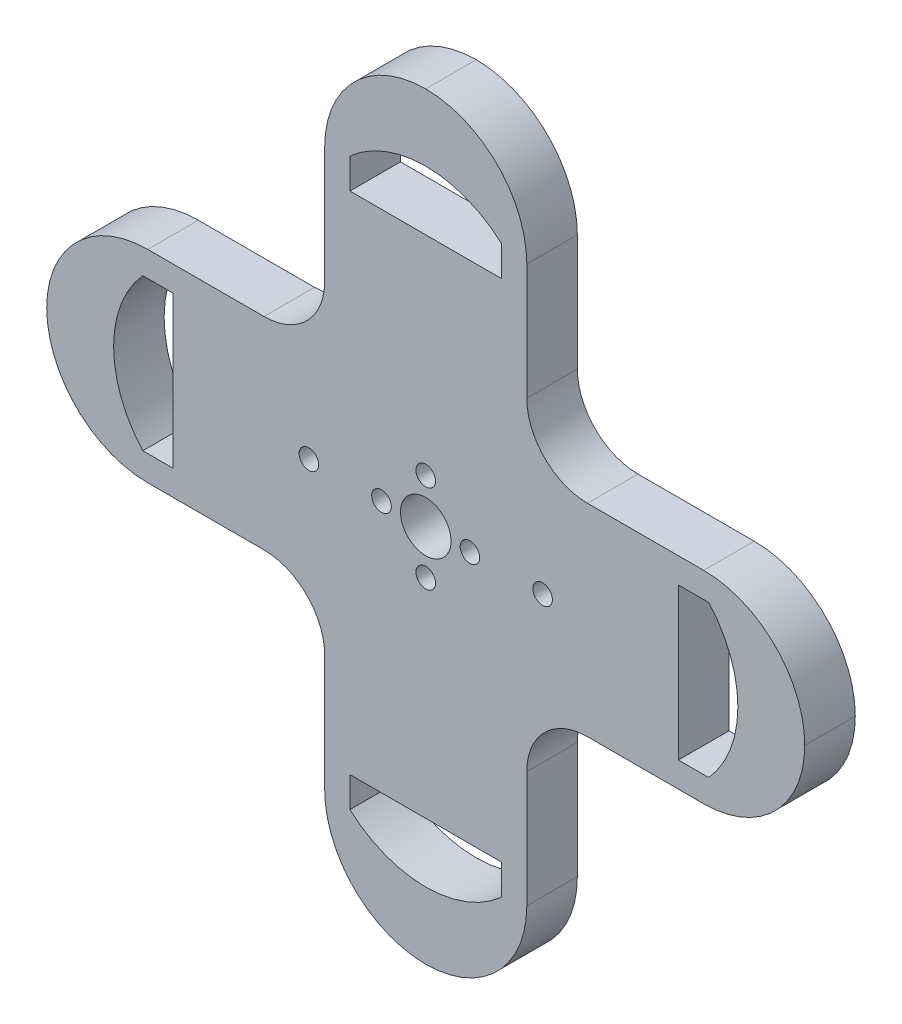
from build123d import *

# Parameters (mm, degrees)
EXTRUDE_1_DEPTH          = 5
CUT_EXTRUDE_1_DEPTH      = 54.268189382
FILLET_1_R               = 10
FILLET_2_R               = 6
SCALE_1_SCALE            = 1.6
CUT_EXTRUDE_2_DEPTH      = 86.229103011
CUT_EXTRUDE_2_DEPTH_BACK = 86.229103011
SKETCH_3_R               = 4
SKETCH_3_R_2             = 1.55


with BuildPart() as part:
    # 草图1 → 凸台-拉伸1 (new body)
    with BuildSketch(Plane.XY):
        Polygon((-10, 32.5), (-10, 10), (-37.5, 10), (-37.5, -10), (-10, -10), (-10, -37.5), (10, -37.5), (10, -10), (37.5, -10), (37.5, 10), (10, 10), (10, 32.5), (10, 37.5), (0, 37.5), (-10, 37.5), align=None)
    extrude(amount=EXTRUDE_1_DEPTH)

    # 草图2 → 切除-拉伸1 (cut, through all)
    with BuildSketch(Plane.XY.offset(5)):
        with BuildLine():
            Line((7.5, 25), (7.5, 28))
            ThreePointArc((7.5, 28), (0, 30.881947343), (-7.5, 28))
            Line((-7.5, 28), (-7.5, 25))
            Line((-7.5, 25), (7.5, 25))
        make_face()
        with BuildLine():
            ThreePointArc((-28, -7.5), (-30.881947343, 0), (-28, 7.5))
            Line((-28, 7.5), (-25, 7.5))
            Line((-25, 7.5), (-25, -7.5))
            Line((-25, -7.5), (-28, -7.5))
        make_face()
        with BuildLine():
            ThreePointArc((7.5, -28), (0, -30.881947343), (-7.5, -28))
            Line((-7.5, -28), (-7.5, -25))
            Line((-7.5, -25), (7.5, -25))
            Line((7.5, -25), (7.5, -28))
        make_face()
        with BuildLine():
            ThreePointArc((28, 7.5), (30.881947343, 0), (28, -7.5))
            Line((28, -7.5), (25, -7.5))
            Line((25, -7.5), (25, 7.5))
            Line((25, 7.5), (28, 7.5))
        make_face()
    extrude(amount=-CUT_EXTRUDE_1_DEPTH, mode=Mode.SUBTRACT)

    # 圆角1
    fillet_1_edges = [part.edges().sort_by_distance(p)[0] for p in [
        (-37.5, 10, 2.5),
        (-37.5, -10, 2.5),
        (-10, -37.5, 2.5),
        (10, -37.5, 2.5),
        (37.5, -10, 2.5),
        (37.5, 10, 2.5),
        (10, 37.5, 2.5),
        (-10, 37.5, 2.5),
    ]]
    fillet(fillet_1_edges, radius=FILLET_1_R - 0.0001)  # a hair under: the kernel refuses the full size

    # 圆角2
    fillet_2_edges = [part.edges().sort_by_distance(p)[0] for p in [
        (10, 10, 2.5),
        (10, -10, 2.5),
        (-10, -10, 2.5),
        (-10, 10, 2.5),
    ]]
    fillet(fillet_2_edges, radius=FILLET_2_R)


with BuildPart() as part_1:
    # 缩放比例1: scaled about (0, 0, 2.5)
    add(part.part.scale(SCALE_1_SCALE).moved(Location((0, 0, -1.5))))

    # 草图3 → 切除-拉伸2 (cut, two sides: drawn at the far end of the back side and taken through both)
    with BuildSketch(Plane.XY.offset(6.5).offset(-CUT_EXTRUDE_2_DEPTH_BACK)):
        Circle(SKETCH_3_R)
        with Locations((-7, 0)):
            Circle(SKETCH_3_R_2)
        with Locations((7, 0)):
            Circle(SKETCH_3_R_2)
        with Locations((0, 7)):
            Circle(SKETCH_3_R_2)
        with Locations((0, -7)):
            Circle(SKETCH_3_R_2)
        with Locations((-18.5, 0)):
            Circle(SKETCH_3_R_2)
        with Locations((18.5, 0)):
            Circle(SKETCH_3_R_2)
    extrude(amount=CUT_EXTRUDE_2_DEPTH + CUT_EXTRUDE_2_DEPTH_BACK, mode=Mode.SUBTRACT)


solid = part_1.part
